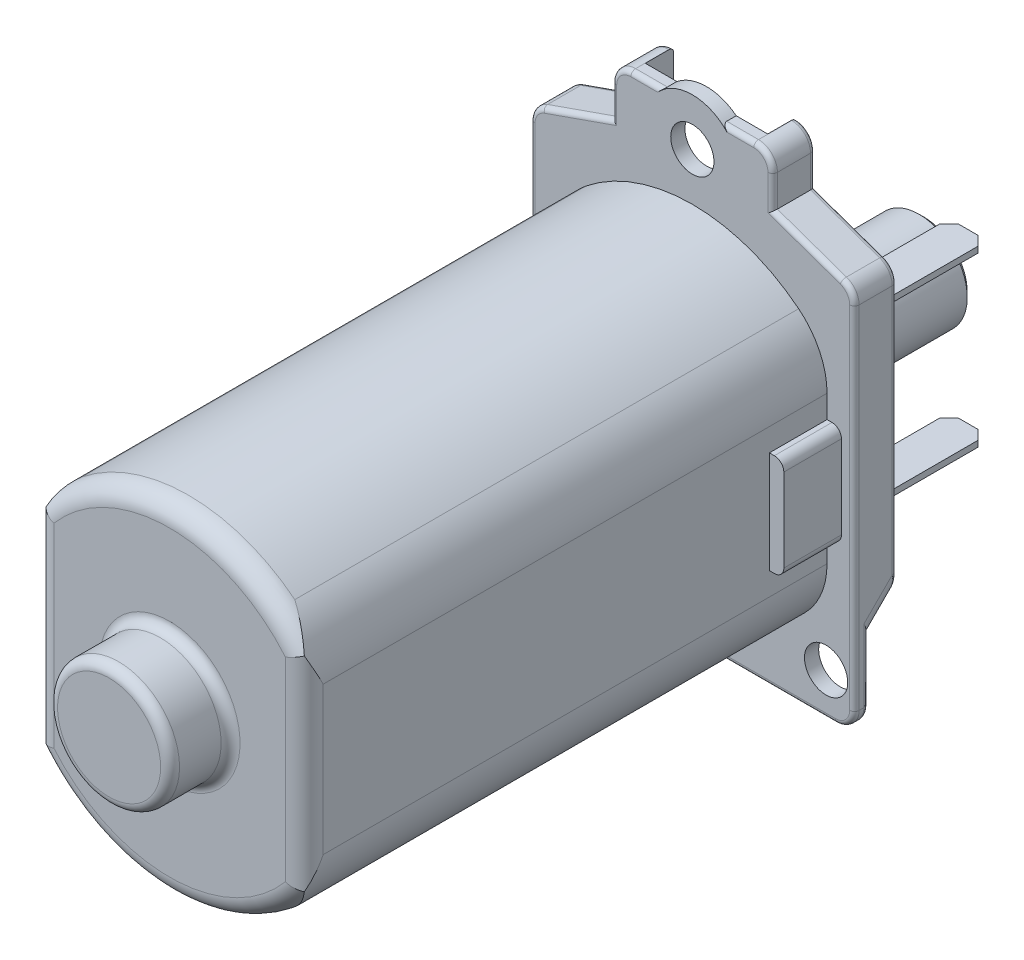
from build123d import *

# Parameters (mm, degrees)
SKETCH1_W            = 34.29
SKETCH1_H            = 48.976493044
BOSS_EXTRUDE1_DEPTH  = 4.5
SKETCH2_W            = 14
SKETCH2_H            = 8.406511393
CUT_EXTRUDE1_DEPTH   = 33.237542404
SKETCH3_W            = 3
SKETCH3_H            = 7.335385762
CUT_EXTRUDE2_DEPTH   = 75.006095798
SKETCH4_W            = 14
SKETCH4_H            = 8.406511393
CUT_EXTRUDE3_DEPTH   = 33.237542404
BOSS_EXTRUDE2_DEPTH  = 55.3
DRAFT1_ANGLE         = 45
DRAFT2_ANGLE         = 19.350680438
DRAFT3_ANGLE         = 19.350680438
SKETCH6_W            = 6.45
SKETCH6_H            = 6.4
FILLET1_R            = 2
FILLET2_START        = -55.3
FILLET2_DEPTH        = 55.3000001
CHAMFER1_SIZE        = 0.5
FILLET3_R            = 0.5
FILLET4_R            = 1
CUT_EXTRUDE4_REACH   = 75.495
SKETCH8_R            = 9.271
SKETCH8_W            = 30.242
SKETCH8_H            = 3.207106781
SKETCH8_H_2          = 6.835385762
SKETCH8_W_2          = 30.29
SKETCH8_H_3          = 3
SKETCH8_W_3          = 12.952
SKETCH8_H_4          = 1
HOLE1_D              = 4.572
HOLE1_DEPTH          = 100
SKETCH11_W           = 3.048
SKETCH11_H           = 10.795
BOSS_EXTRUDE3_DEPTH  = 6.096
FILLET5_R            = 1
FILLET5_OF_MIRROR1_R = 1
SKETCH12_R           = 2.54
CUT_EXTRUDE5_DEPTH   = 8.89
SKETCH14_W           = 4.064
SKETCH14_H           = 0.635
BOSS_EXTRUDE4_DEPTH  = 1.524
SKETCH15_W           = 4.064
SKETCH15_H           = 0.635
BOSS_EXTRUDE5_DEPTH  = 19.558
CHAMFER2_SIZE        = 1
FILLET6_R            = 2
BOSS_EXTRUDE6_START  = -1.500002
SKETCH16_R           = 5
SKETCH16_R_2         = 2.286
BOSS_EXTRUDE6_DEPTH  = 1.500002
SKETCH17_W           = 6.7
SKETCH17_H           = 1.3
SKETCH17_W_2         = 1.3
SKETCH17_H_2         = 6.7
BOSS_EXTRUDE7_DEPTH  = 1.88
CUT_EXTRUDE6_REACH   = 91.709
CUT_EXTRUDE7_REACH   = 92.895
CIRPATTERN1_COUNT    = 2


with BuildPart() as part:
    # Sketch1 → Boss-Extrude1 (new body)
    with BuildSketch(Plane(origin=(0, 0, -59.8), x_dir=(-1, 0, 0), z_dir=(0, 0, -1))):
        with Locations((0, 2.438656665)):
            Rectangle(SKETCH1_W, SKETCH1_H)
    extrude(amount=-BOSS_EXTRUDE1_DEPTH)

    # Sketch2 → Cut-Extrude1 (cut, through all)
    with BuildSketch(Plane.XY.offset(-55.3)):
        with Locations((-15.5, 22.72364749)):
            Rectangle(SKETCH2_W, SKETCH2_H)
    extrude(amount=-CUT_EXTRUDE1_DEPTH, mode=Mode.SUBTRACT)

    # Sketch3 → Cut-Extrude2 (cut, through all)
    with BuildSketch(Plane.ZY.offset(17.145)):
        with Locations((-58.3, -18.381896976)):
            Rectangle(SKETCH3_W, SKETCH3_H)
    extrude(amount=-CUT_EXTRUDE2_DEPTH, mode=Mode.SUBTRACT)

    # Sketch4 → Cut-Extrude3 (cut, through all)
    with BuildSketch(Plane.XY.offset(-55.3)):
        with Locations((15.5, 22.72364749)):
            Rectangle(SKETCH4_W, SKETCH4_H)
    extrude(amount=-CUT_EXTRUDE3_DEPTH, mode=Mode.SUBTRACT)

    # Sketch5 → Boss-Extrude2 (add)
    with BuildSketch(Plane.XY.offset(-55.3)):
        with BuildLine():
            Line((-14.247806849, -11), (-14.247806849, 11))
            ThreePointArc((-14.247806849, 11), (0, 18), (14.247806849, 11))
            Line((14.247806849, 11), (14.247806849, -11))
            ThreePointArc((14.247806849, -11), (0, -18), (-14.247806849, -11))
        make_face()
    extrude(amount=BOSS_EXTRUDE2_DEPTH)

    # Draft1
    draft1_faces = [part.faces().sort_by_distance(p)[0] for p in [
        (0, -14.714204095, -58.3),
    ]]
    draft(draft1_faces, Plane(origin=(17.145, -22.049589857, -56.8), x_dir=(-1, 0, 0), z_dir=(0, 0, -1)), DRAFT1_ANGLE)

    # Draft2
    draft2_faces = [part.faces().sort_by_distance(p)[0] for p in [
        (-12.8225, 18.520391794, -57.55),
    ]]
    draft(draft2_faces, Plane(origin=(-17.145, -22.049589857, -55.3), x_dir=(0, -1, 0), z_dir=(-1, 0, 0)), DRAFT2_ANGLE)

    # Draft3
    draft3_faces = [part.faces().sort_by_distance(p)[0] for p in [
        (12.8225, 18.520391794, -57.55),
    ]]
    draft(draft3_faces, Plane(origin=(17.145, 26.926903187, -55.3), x_dir=(0, 1, 0), z_dir=(1, 0, 0)), DRAFT3_ANGLE)

    # Sketch6 → Revolve1 (revolve)
    with BuildSketch(Plane(origin=(0, 0, 0), x_dir=(1, 0, 0), z_dir=(0, 1, 0))):
        with Locations((3.225, -3.2)):
            Rectangle(SKETCH6_W, SKETCH6_H)
    revolve(axis=Axis((0, 0, 0), (0, 0, 1)))

    # Sketch7 → Revolve2 (revolve)
    with BuildSketch(Plane.XZ, mode=Mode.PRIVATE) as revolve2_sk:
        Polygon((9.271, -59.8), (0, -59.8), (0, -79.8), (5.08, -79.8), (5.08, -65.5), (9.271, -65.5), align=None)
    revolve(revolve2_sk.sketch.rotate(Axis((0, 0, -59.8), (0, 0, -1)), 270), axis=Axis((0, 0, -59.8), (0, 0, -1)))

    # Fillet1
    fillet1_edges = [part.edges().sort_by_distance(p)[0] for p in [
        (-17.145, 18.520391794, -57.55),
        (-8.5, 26.926903187, -57.55),
        (17.145, -13.214204095, -58.3),
        (-17.145, -13.214204095, -58.3),
        (17.145, 18.520391794, -57.55),
        (8.5, 26.926903187, -57.55),
        (0, -18, 0),
        (14.247806849, 0, 0),
        (0, 18, 0),
        (-14.247806849, 0, 0),
        (-17.145, -22.049589857, -56.05),
        (17.145, -22.049589857, -56.05),
    ]]
    fillet(fillet1_edges, radius=FILLET1_R)

    # Fillet2: read off the stored shape, not the designer's step
    # Fillet2 outline → Fillet2 (cut)
    with BuildSketch(Plane.XY.offset(FILLET2_START)):
        with BuildLine():
            ThreePointArc((14.247806849, 11), (12.838090271, 12.616791914), (11.246052328, 14.054405254))
            ThreePointArc((11.246052328, 14.054405254), (13.458422767, 11.273117359), (14.247806849, 7.808002919))
            Line((14.247806849, 7.808002919), (14.247806849, 11))
        make_face()
        with BuildLine():
            ThreePointArc((-14.247806849, 7.808002919), (-13.458422767, 11.273117359), (-11.246052328, 14.054405254))
            ThreePointArc((-11.246052328, 14.054405254), (-12.838090271, 12.616791914), (-14.247806849, 11))
            Line((-14.247806849, 11), (-14.247806849, 7.808002919))
        make_face()
        with BuildLine():
            Line((14.247806849, -11), (14.247806849, -7.808002919))
            ThreePointArc((14.247806849, -7.808002919), (13.458422767, -11.273117359), (11.246052328, -14.054405254))
            ThreePointArc((11.246052328, -14.054405254), (12.838090271, -12.616791914), (14.247806849, -11))
        make_face()
        with BuildLine():
            ThreePointArc((-11.246052328, -14.054405254), (-13.458422767, -11.273117359), (-14.247806849, -7.808002919))
            Line((-14.247806849, -7.808002919), (-14.247806849, -11))
            ThreePointArc((-14.247806849, -11), (-12.838090271, -12.616791914), (-11.246052328, -14.054405254))
        make_face()
    extrude(amount=FILLET2_DEPTH, mode=Mode.SUBTRACT)

    # Chamfer1
    chamfer1_edges = [part.edges().sort_by_distance(p)[0] for p in [
        (0, -5.08, -79.8),
    ]]
    chamfer(chamfer1_edges, length=CHAMFER1_SIZE)

    # Fillet3
    fillet3_edges = [part.edges().sort_by_distance(p)[0] for p in [
        (8.5, 23.241659112, -55.3),
        (-8.5, 23.241659112, -55.3),
        (7.914213562, 26.341116749, -55.3),
        (-7.914213562, 26.341116749, -55.3),
        (0, 26.926903187, -55.3),
        (-12.153849093, 20.273225821, -55.3),
        (-16.776777616, 18.25943781, -55.3),
        (-17.145, -1.473284855, -55.3),
        (-16.559213562, -21.46380342, -55.3),
        (0, -22.049589857, -55.3),
        (16.559213562, -21.46380342, -55.3),
        (17.145, -1.473284855, -55.3),
        (12.153849093, 20.273225821, -55.3),
        (16.776777616, 18.25943781, -55.3),
        (17.145, -15.967683414, -56.8),
        (-17.145, -15.967683414, -56.8),
        (16.559213562, -21.46380342, -56.8),
        (-16.559213562, -21.46380342, -56.8),
        (0, -22.049589857, -56.8),
        (8.5, 23.241659112, -59.8),
        (7.914213562, 26.341116749, -59.8),
        (0, 26.926903187, -59.8),
        (-7.914213562, 26.341116749, -59.8),
        (-8.5, 23.241659112, -59.8),
        (12.153849093, 20.273225821, -59.8),
        (16.776777616, 18.25943781, -59.8),
        (17.145, 4.108621588, -59.8),
        (16.671592034, -10.713079224, -59.8),
        (0, -11.714204095, -59.8),
        (-16.671592034, -10.713079224, -59.8),
        (-17.145, 4.108621588, -59.8),
        (-16.776777616, 18.25943781, -59.8),
        (-12.153849093, 20.273225821, -59.8),
    ]]
    fillet(fillet3_edges, radius=FILLET3_R)

    # Fillet4
    fillet4_edges = [part.edges().sort_by_distance(p)[0] for p in [
        (-6.45, 0, 0),
        (-6.45, 0, 6.4),
        (0, -9.271, -65.5),
    ]]
    fillet(fillet4_edges, radius=FILLET4_R)

    # Cut-Extrude4: up to this face of the body (flat: up to its plane)
    cut_extrude4_end = Plane(part.part.faces().sort_by_distance((0, -18.104490629, -56.8))[0])
    # Sketch8 → Cut-Extrude4 (cut, up to the picked face)
    with BuildSketch(Plane(origin=(0, 0, -59.8), x_dir=(-1, 0, 0), z_dir=(0, 0, -1)), mode=Mode.PRIVATE) as cut_extrude4_sk1:
        Polygon((-6.476, 26.426903187), (-6.476, 20.12203493), (-15.121, 17.086011687), (-15.121, -11.507097314), (15.121, -11.507097314), (15.121, 17.086011687), (6.476, 20.12203493), (6.476, 26.426903187), align=None)
        with Locations(Location((0, 0, 0), (0, 0, 90))):
            Circle(SKETCH8_R, mode=Mode.SUBTRACT)
    cut_extrude4_tool1 = split(extrude(cut_extrude4_sk1.sketch, amount=-CUT_EXTRUDE4_REACH, mode=Mode.PRIVATE), bisect_by=cut_extrude4_end, keep=Keep.BOTH, mode=Mode.PRIVATE)
    # Sketch8 → Cut-Extrude4 (cut, up to the picked face)
    with BuildSketch(Plane(origin=(0, 0, -59.8), x_dir=(-1, 0, 0), z_dir=(0, 0, -1)), mode=Mode.PRIVATE) as cut_extrude4_sk2:
        with Locations((0, -13.110650705)):
            Rectangle(SKETCH8_W, SKETCH8_H)
    cut_extrude4_tool2 = split(extrude(cut_extrude4_sk2.sketch, amount=-CUT_EXTRUDE4_REACH, mode=Mode.PRIVATE), bisect_by=cut_extrude4_end, keep=Keep.BOTH, mode=Mode.PRIVATE)
    # Sketch8 → Cut-Extrude4 (cut, up to the picked face)
    with BuildSketch(Plane(origin=(0, 0, -59.8), x_dir=(-1, 0, 0), z_dir=(0, 0, -1)), mode=Mode.PRIVATE) as cut_extrude4_sk3:
        with Locations((0, -18.131896976)):
            Rectangle(SKETCH8_W, SKETCH8_H_2)
    cut_extrude4_tool3 = split(extrude(cut_extrude4_sk3.sketch, amount=-CUT_EXTRUDE4_REACH, mode=Mode.PRIVATE), bisect_by=cut_extrude4_end, keep=Keep.BOTH, mode=Mode.PRIVATE)
    # Sketch8 → Cut-Extrude4 (cut, up to the picked face)
    with BuildSketch(Plane(origin=(0, 0, -59.8), x_dir=(-1, 0, 0), z_dir=(0, 0, -1)), mode=Mode.PRIVATE) as cut_extrude4_sk4:
        with Locations((0, -23.049589857)):
            Rectangle(SKETCH8_W_2, SKETCH8_H_3)
    cut_extrude4_tool4 = split(extrude(cut_extrude4_sk4.sketch, amount=-CUT_EXTRUDE4_REACH, mode=Mode.PRIVATE), bisect_by=cut_extrude4_end, keep=Keep.BOTH, mode=Mode.PRIVATE)
    # Sketch8 → Cut-Extrude4 (cut, up to the picked face)
    with BuildSketch(Plane(origin=(0, 0, -59.8), x_dir=(-1, 0, 0), z_dir=(0, 0, -1)), mode=Mode.PRIVATE) as cut_extrude4_sk5:
        with Locations((0, 26.926903187)):
            Rectangle(SKETCH8_W_3, SKETCH8_H_4)
    cut_extrude4_tool5 = split(extrude(cut_extrude4_sk5.sketch, amount=-CUT_EXTRUDE4_REACH, mode=Mode.PRIVATE), bisect_by=cut_extrude4_end, keep=Keep.BOTH, mode=Mode.PRIVATE)
    add(cut_extrude4_tool1.solids().sort_by(Axis((5.990864, 23.274469, -59.8), (0, 0, 1)))[0], mode=Mode.SUBTRACT)
    add(cut_extrude4_tool2.solids().sort_by(Axis((0, -13.110651, -59.8), (0, 0, 1)))[0], mode=Mode.SUBTRACT)
    add(cut_extrude4_tool3.solids().sort_by(Axis((0, -18.131897, -59.8), (0, 0, 1)))[0], mode=Mode.SUBTRACT)
    add(cut_extrude4_tool4.solids().sort_by(Axis((0, -23.04959, -59.8), (0, 0, 1)))[0], mode=Mode.SUBTRACT)
    add(cut_extrude4_tool5.solids().sort_by(Axis((0, 26.926903, -59.8), (0, 0, 1)))[0], mode=Mode.SUBTRACT)

    # Hole1
    with Locations(Plane(origin=(0, 0, -56.8), x_dir=(-1, 0, 0), z_dir=(0, 0, -1))):
        with Locations((0, 23.035410143), (14.15, -17.604589857), (-14.15, -17.604589857)):
            Hole(HOLE1_D / 2, depth=HOLE1_DEPTH)

    # Sketch11 → Boss-Extrude3 (add)
    with BuildSketch(Plane.XY.offset(-55.3)):
        with Locations((-14.247806849, 0)):
            Rectangle(SKETCH11_W, SKETCH11_H)
    boss_extrude3 = extrude(amount=BOSS_EXTRUDE3_DEPTH)

    # Fillet5
    fillet5_edges = [part.edges().sort_by_distance(p)[0] for p in [
        (-15.771806849, -5.3975, -52.252),
        (-15.771806849, 5.3975, -52.252),
    ]]
    fillet(fillet5_edges, radius=FILLET5_R)

    # Mirror1: Boss-Extrude3 across plane
    add(boss_extrude3.mirror(Plane(origin=(0, 0, 0), x_dir=(0, 0, 1), z_dir=(1, 0, 0))))

    # Fillet5 of Mirror1
    fillet5_of_mirror1_edges = [part.edges().sort_by_distance(p)[0] for p in [
        (15.771806849, -5.3975, -52.252),
        (15.771806849, 5.3975, -52.252),
    ]]
    fillet(fillet5_of_mirror1_edges, radius=FILLET5_OF_MIRROR1_R)

    # Sketch12 → Cut-Extrude5 (cut)
    with BuildSketch(Plane(origin=(0, 0, -79.8), x_dir=(-1, 0, 0), z_dir=(0, 0, -1))):
        with Locations(Location((0, 0, 0), (0, 0, 90))):
            Circle(SKETCH12_R)
    extrude(amount=-CUT_EXTRUDE5_DEPTH, mode=Mode.SUBTRACT)

    # Sketch14 → Boss-Extrude4 (add)
    # profile 1 of 2: a face of its own
    with BuildSketch(Plane(origin=(0, 0, -56.8), x_dir=(-1, 0, 0), z_dir=(0, 0, -1))):
        with BuildLine():
            Line((-10.16, 10.668), (-6.096, 10.668))
            ThreePointArc((-6.096, 10.668), (-4.318, 8.89), (-6.096, 7.112))
            Line((-6.096, 7.112), (-10.16, 7.112))
            ThreePointArc((-10.16, 7.112), (-11.938, 8.89), (-10.16, 10.668))
        make_face()
        with Locations((-8.128, 8.89)):
            Rectangle(SKETCH14_W, SKETCH14_H, mode=Mode.SUBTRACT)
    # profile 2 of 2: a face of its own
    with BuildSketch(Plane(origin=(0, 0, -56.8), x_dir=(-1, 0, 0), z_dir=(0, 0, -1))):
        with BuildLine():
            Line((-10.16, -7.112), (-6.096, -7.112))
            ThreePointArc((-6.096, -7.112), (-4.318, -8.89), (-6.096, -10.668))
            Line((-6.096, -10.668), (-10.16, -10.668))
            ThreePointArc((-10.16, -10.668), (-11.938, -8.89), (-10.16, -7.112))
        make_face()
        with Locations((-8.128, -8.89)):
            Rectangle(SKETCH14_W, SKETCH14_H, mode=Mode.SUBTRACT)
    extrude(amount=BOSS_EXTRUDE4_DEPTH)

    # Sketch15 → Boss-Extrude5 (add)
    with BuildSketch(Plane(origin=(0, 0, -56.8), x_dir=(-1, 0, 0), z_dir=(0, 0, -1))):
        with Locations((-8.128, 8.89)):
            Rectangle(SKETCH15_W, SKETCH15_H)
        with Locations((-8.128, -8.89)):
            Rectangle(SKETCH15_W, SKETCH15_H)
    extrude(amount=BOSS_EXTRUDE5_DEPTH)

    # Chamfer2
    chamfer2_edges = [part.edges().sort_by_distance(p)[0] for p in [
        (10.16, 8.89, -76.358),
        (6.096, 8.89, -76.358),
        (10.16, -8.89, -76.358),
        (6.096, -8.89, -76.358),
    ]]
    chamfer(chamfer2_edges, length=CHAMFER2_SIZE)

    # Fillet6
    fillet6_edges = [part.edges().sort_by_distance(p)[0] for p in [
        (-15.121, 17.086011687, -58.3),
        (-6.476, 20.12203493, -58.3),
        (15.121, 17.086011687, -58.3),
        (6.476, 20.12203493, -58.3),
    ]]
    fillet(fillet6_edges, radius=FILLET6_R)

    # Sketch16 → Boss-Extrude6 (add)
    with BuildSketch(Plane(origin=(0, 0, -56.8), x_dir=(-1, 0, 0), z_dir=(0, 0, -1)).offset(BOSS_EXTRUDE6_START)):
        with Locations((0, 23.035410143)):
            Circle(SKETCH16_R)
        with Locations((0, 23.035410143)):
            Circle(SKETCH16_R_2, mode=Mode.SUBTRACT)
    extrude(amount=BOSS_EXTRUDE6_DEPTH)

    # Sketch17 → Boss-Extrude7 (add)
    with BuildSketch(Plane(origin=(0, 0, -56.8), x_dir=(-1, 0, 0), z_dir=(0, 0, -1))):
        with Locations((0, 17.3)):
            Rectangle(SKETCH17_W, SKETCH17_H)
        with Locations((13.4, 0)):
            Rectangle(SKETCH17_W_2, SKETCH17_H_2)
    boss_extrude7 = extrude(amount=BOSS_EXTRUDE7_DEPTH)

    # Sketch18 → Cut-Extrude6 (cut, up to next)
    with BuildSketch(Plane(origin=(-12.75, 0, 0), x_dir=(0, 0, -1), z_dir=(1, 0, 0)), mode=Mode.PRIVATE) as cut_extrude6_sk1:
        Polygon((56.8, 0), (58.68, 0), (58.68, 1.88), align=None)
    cut_extrude6_tool1 = extrude(cut_extrude6_sk1.sketch, amount=-CUT_EXTRUDE6_REACH, mode=Mode.PRIVATE) & part.part
    # Sketch18 → Cut-Extrude6 (cut, up to next)
    with BuildSketch(Plane(origin=(-12.75, 0, 0), x_dir=(0, 0, -1), z_dir=(1, 0, 0)), mode=Mode.PRIVATE) as cut_extrude6_sk2:
        Polygon((58.68, -1.88), (58.68, 0), (56.8, 0), align=None)
    cut_extrude6_tool2 = extrude(cut_extrude6_sk2.sketch, amount=-CUT_EXTRUDE6_REACH, mode=Mode.PRIVATE) & part.part
    cut_extrude6_1 = cut_extrude6_tool1.solids().sort_by_distance((-12.75, 0.626667, -58.053333))[0]
    add(cut_extrude6_1, mode=Mode.SUBTRACT)
    cut_extrude6_2 = cut_extrude6_tool2.solids().sort_by_distance((-12.75, -0.626667, -58.053333))[0]
    add(cut_extrude6_2, mode=Mode.SUBTRACT)
    cut_extrude6 = cut_extrude6_1 + cut_extrude6_2  # Cut-Extrude6 as one shape, for the pattern or mirror that repeats it

    # Sketch19 → Cut-Extrude7 (cut, up to next)
    with BuildSketch(Plane(origin=(0, 17.95, 0), x_dir=(1, 0, 0), z_dir=(0, 1, 0)), mode=Mode.PRIVATE) as cut_extrude7_sk1:
        Polygon((1.88, 58.68), (0, 58.68), (0, 56.8), align=None)
    cut_extrude7_tool1 = extrude(cut_extrude7_sk1.sketch, amount=-CUT_EXTRUDE7_REACH, mode=Mode.PRIVATE) & part.part
    # Sketch19 → Cut-Extrude7 (cut, up to next)
    with BuildSketch(Plane(origin=(0, 17.95, 0), x_dir=(1, 0, 0), z_dir=(0, 1, 0)), mode=Mode.PRIVATE) as cut_extrude7_sk2:
        Polygon((0, 56.8), (0, 58.68), (-1.88, 58.68), align=None)
    cut_extrude7_tool2 = extrude(cut_extrude7_sk2.sketch, amount=-CUT_EXTRUDE7_REACH, mode=Mode.PRIVATE) & part.part
    cut_extrude7_1 = cut_extrude7_tool1.solids().sort_by_distance((0.626667, 17.95, -58.053333))[0]
    add(cut_extrude7_1, mode=Mode.SUBTRACT)
    cut_extrude7_2 = cut_extrude7_tool2.solids().sort_by_distance((-0.626667, 17.95, -58.053333))[0]
    add(cut_extrude7_2, mode=Mode.SUBTRACT)
    cut_extrude7 = cut_extrude7_1 + cut_extrude7_2  # Cut-Extrude7 as one shape, for the pattern or mirror that repeats it

    # CirPattern1: Boss-Extrude7, Cut-Extrude6, Cut-Extrude7 ×2 about axis
    cirpattern1_axis = Axis((0, 0, 0), (0, 0, 1))
    add([boss_extrude7.rotate(cirpattern1_axis, i * 360 / CIRPATTERN1_COUNT) for i in range(1, CIRPATTERN1_COUNT)])
    add([cut_extrude6.rotate(cirpattern1_axis, i * 360 / CIRPATTERN1_COUNT) for i in range(1, CIRPATTERN1_COUNT)], mode=Mode.SUBTRACT)
    add([cut_extrude7.rotate(cirpattern1_axis, i * 360 / CIRPATTERN1_COUNT) for i in range(1, CIRPATTERN1_COUNT)], mode=Mode.SUBTRACT)


solid = part.part
